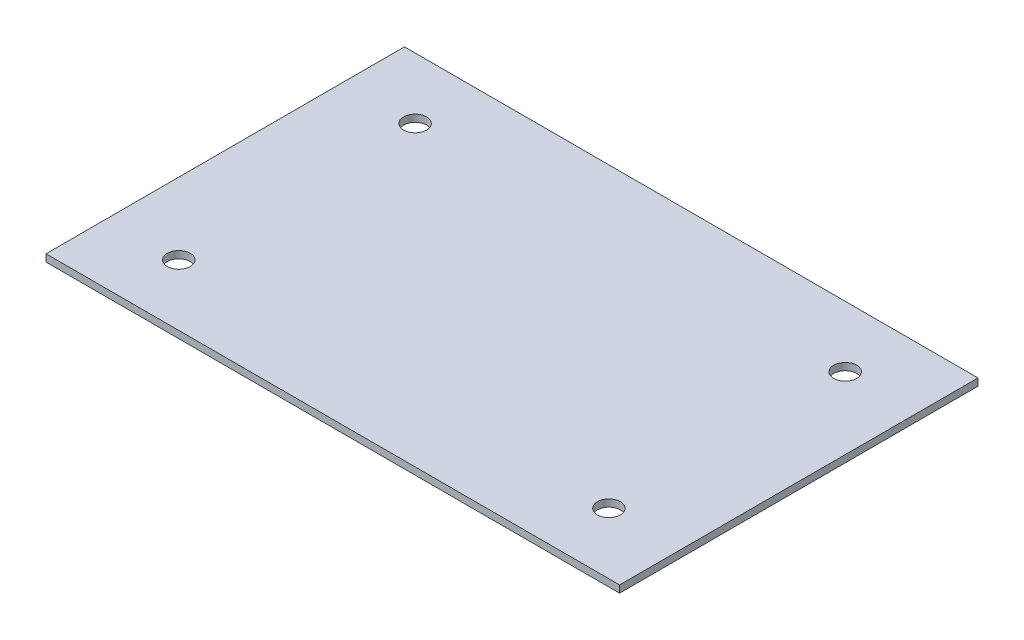
from build123d import *

# Parameters (mm, degrees)
SKETCH_1_W      = 160
SKETCH_1_H      = 100
SKETCH_1_R      = 3.2
EXTRUDE_1_DEPTH = 2


with BuildPart() as part:
    # Эскиз1 → Бобышка-Вытянуть1 (new body)
    with BuildSketch(Plane(origin=(0, 0, 0), x_dir=(1, 0, 0), z_dir=(0, 1, 0))):
        with Locations((80, 50)):
            Rectangle(SKETCH_1_W, SKETCH_1_H)
        with Locations((140, 17.034247801)):
            Circle(SKETCH_1_R, mode=Mode.SUBTRACT)
        with Locations((20, 17.034247801)):
            Circle(SKETCH_1_R, mode=Mode.SUBTRACT)
        with Locations((140, 82.965752199)):
            Circle(SKETCH_1_R, mode=Mode.SUBTRACT)
        with Locations((20, 82.965752199)):
            Circle(SKETCH_1_R, mode=Mode.SUBTRACT)
    extrude(amount=EXTRUDE_1_DEPTH)


solid = part.part
